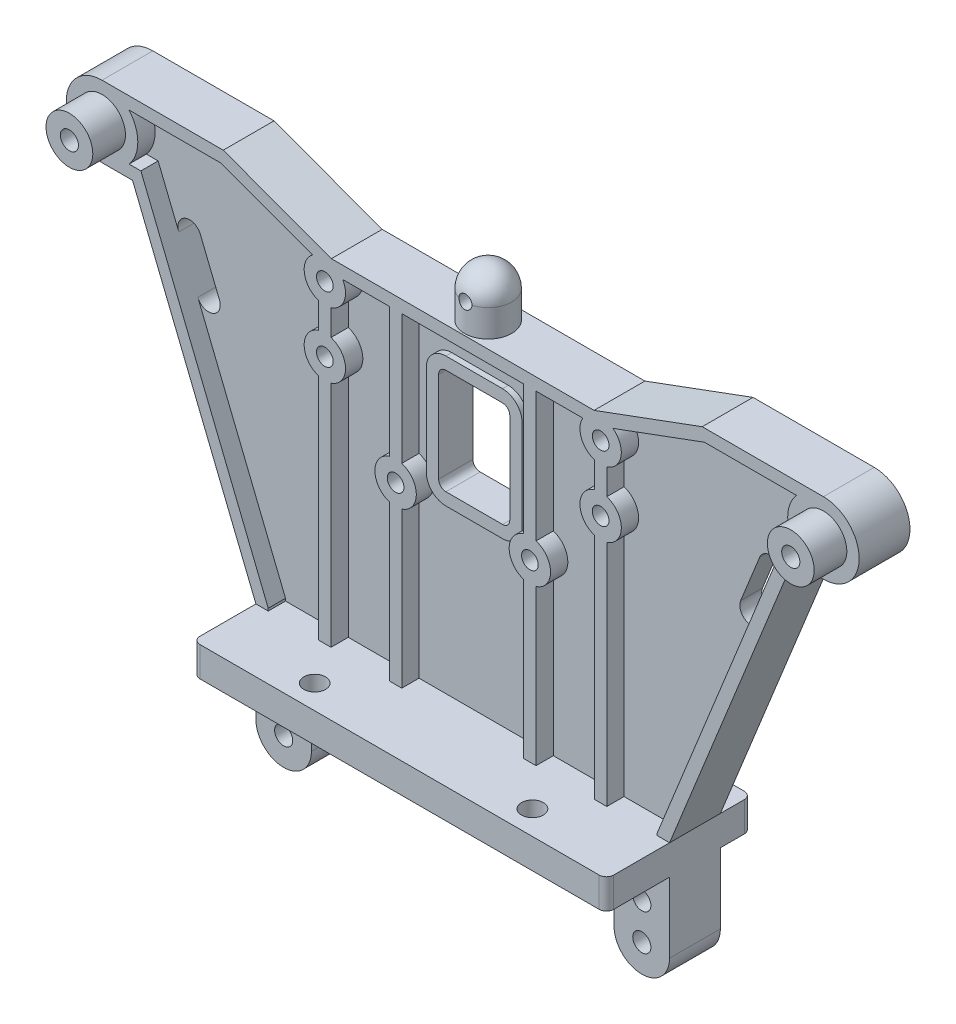
from build123d import *
from build123d.topology import SkipClean

# Parameters (mm, degrees)
BOSS_EXTRUDE1_DEPTH     = 3.5
CUT_EXTRUDE1_DEPTH      = 2.38
RIB3_START              = -2.38
RIB3_OUTLINE_R          = 1.15
RIB3_DEPTH              = 2.38
CUT_EXTRUDE2_DEPTH      = 85.268825938
CUT_EXTRUDE2_DEPTH_BACK = 85.268825938
SKETCH5_R               = 1.15
SKETCH5_R_2             = 1.25
CUT_EXTRUDE3_DEPTH      = 1.6
RIB6_START              = -1.6
RIB6_OUTLINE_R          = 1.15
RIB6_DEPTH              = 1.6
BOSS_EXTRUDE2_START     = 6.88
SKETCH8_R               = 3.225
SKETCH8_R_2             = 1.25
BOSS_EXTRUDE2_DEPTH     = 6.88
SKETCH9_R               = 1.5
BOSS_EXTRUDE3_DEPTH     = 4.1
SKETCH10_R              = 1.5
CUT_EXTRUDE4_DEPTH      = 11.5
EXTRUDE_THIN1_START     = 0.9
EXTRUDE_THIN1_DEPTH     = 0.9
EXTRUDE_THIN2_DEPTH     = 0.8
CUT_EXTRUDE5_DEPTH      = 86.021942021
CUT_EXTRUDE5_DEPTH_BACK = 86.021942021
SKETCH14_R              = 0.9


# Read off the part's stored shape, not the designer's step: Rib3, Rib6
with BuildPart() as part:
    # Sketch1 → Boss-Extrude1 (new, symmetric)
    with BuildSketch(Plane.XY):
        with BuildLine():
            Line((-49.7, 5.5), (-33, 5.5))
            Line((-33, 5.5), (-18.1, 0))
            Line((-18.1, 0), (0, 0))
            Line((0, 0), (0, -50.5))
            Line((0, -50.5), (-20.85, -50.5))
            Line((-20.85, -50.5), (-20.85, -60.175))
            ThreePointArc((-20.85, -60.175), (-24.675, -64), (-28.5, -60.175))
            Line((-28.5, -60.175), (-28.5, -46.4))
            Line((-28.5, -46.4), (-45.5, -4.35))
            Line((-45.5, -4.35), (-49.7, -4.35))
            ThreePointArc((-49.7, -4.35), (-54.625, 0.575), (-49.7, 5.5))
        make_face()
    extrude(amount=BOSS_EXTRUDE1_DEPTH, both=True)

    # Sketch3 → Cut-Extrude1 (cut)
    with BuildSketch(Plane.XY.offset(3.5)):
        with BuildLine():
            ThreePointArc((-49.7, 3.8), (-52.925, 0.575), (-49.7, -2.65))
            Line((-49.7, -2.65), (-44.35360594, -2.65))
            Line((-44.35360594, -2.65), (-26.8, -46.069360574))
            Line((-26.8, -46.069360574), (-26.8, -46.4))
            Line((-26.8, -46.4), (0, -46.4))
            Line((0, -46.4), (0, -1.7))
            Line((0, -1.7), (-18.403742086, -1.7))
            Line((-18.403742086, -1.7), (-33.303742086, 3.8))
            Line((-33.303742086, 3.8), (-49.7, 3.8))
        make_face()
    extrude(amount=-CUT_EXTRUDE1_DEPTH, mode=Mode.SUBTRACT)

    # Rib3 outline → Rib3 (add)
    # profile 1 of 3: a face of its own
    with BuildSketch(Plane.XY.offset(3.5).offset(RIB3_START)):
        with BuildLine():
            ThreePointArc((-10.1, -19.579705898), (-12.1, -22.3), (-10.1, -25.020294102))
            Line((-10.1, -25.020294102), (-10.1, -46.4))
            Line((-10.1, -46.4), (-8.4, -46.4))
            Line((-8.4, -46.4), (-8.4, -25.020294102))
            ThreePointArc((-8.4, -25.020294102), (-6.4, -22.3), (-8.4, -19.579705898))
            Line((-8.4, -19.579705898), (-8.4, -1.7))
            Line((-8.4, -1.7), (-10.1, -1.7))
            Line((-10.1, -1.7), (-10.1, -19.579705898))
        make_face()
        with Locations((-9.25, -22.3)):
            Circle(RIB3_OUTLINE_R, mode=Mode.SUBTRACT)
    # profile 2 of 3: a face of its own
    with BuildSketch(Plane.XY.offset(3.5).offset(RIB3_START)):
        with BuildLine():
            ThreePointArc((-45.977769486, -2.65), (-44.775, 0.575), (-45.977769486, 3.8))
            Line((-45.977769486, 3.8), (-49.7, 3.8))
            ThreePointArc((-49.7, 3.8), (-46.475, 0.575), (-49.7, -2.65))
            Line((-49.7, -2.65), (-45.977769486, -2.65))
        make_face()
    # profile 3 of 3: a face of its own
    with BuildSketch(Plane.XY.offset(3.5).offset(RIB3_START)):
        with BuildLine():
            Line((-19.85, -46.4), (-18.15, -46.4))
            Line((-18.15, -46.4), (-18.15, -14.870294102))
            ThreePointArc((-18.15, -14.870294102), (-16.15, -12.15), (-18.15, -9.429705898))
            Line((-18.15, -9.429705898), (-18.15, -5.870294102))
            ThreePointArc((-18.15, -5.870294102), (-16.339881586, -4.172873415), (-16.546431171, -1.7))
            Line((-16.546431171, -1.7), (-18.403742086, -1.7))
            Line((-18.403742086, -1.7), (-20.690852857, -0.855764481))
            ThreePointArc((-20.690852857, -0.855764481), (-21.81075793, -3.621317155), (-19.85, -5.870294102))
            Line((-19.85, -5.870294102), (-19.85, -9.429705898))
            ThreePointArc((-19.85, -9.429705898), (-21.85, -12.15), (-19.85, -14.870294102))
            Line((-19.85, -14.870294102), (-19.85, -46.4))
        make_face()
        with Locations((-19, -12.15)):
            Circle(RIB3_OUTLINE_R, mode=Mode.SUBTRACT)
        with Locations((-19, -3.15)):
            Circle(RIB3_OUTLINE_R, mode=Mode.SUBTRACT)
    extrude(amount=RIB3_DEPTH)

    # Sketch5 → Cut-Extrude2 (cut, two sides: drawn at the far end of the back side and taken through both)
    with BuildSketch(Plane.XY.offset(1.12).offset(-CUT_EXTRUDE2_DEPTH_BACK)):
        with Locations(Location((-19, -3.15, 0), (0, 0, 180))):
            Circle(SKETCH5_R)
        with Locations(Location((-19, -12.15, 0), (0, 0, 180))):
            Circle(SKETCH5_R)
        with Locations(Location((-9.25, -22.3, 0), (0, 0, 180))):
            Circle(SKETCH5_R)
        with Locations((-24.675, -60.175)):
            Circle(SKETCH5_R_2)
        with Locations((-24.675, -55.175)):
            Circle(SKETCH5_R_2)
        with Locations((-49.7, 0.575)):
            Circle(SKETCH5_R_2)
        with BuildLine():
            Line((0, -7), (-3.9, -7))
            ThreePointArc((-3.9, -7), (-4.607106781, -7.292893219), (-4.9, -8))
            Line((-4.9, -8), (-4.9, -20.5))
            ThreePointArc((-4.9, -20.5), (-4.607106781, -21.207106781), (-3.9, -21.5))
            Line((-3.9, -21.5), (0, -21.5))
            Line((0, -21.5), (0, -7))
        make_face()
        with BuildLine():
            Line((-38.536824782, -8.500305063), (-35.913159432, -14.990018472))
            ThreePointArc((-35.913159432, -14.990018472), (-36.79682756, -17.073076474), (-38.879885562, -16.189408346))
            Line((-38.879885562, -16.189408346), (-41.503550912, -9.699694937))
            ThreePointArc((-41.503550912, -9.699694937), (-40.619882784, -7.616636935), (-38.536824782, -8.500305063))
        make_face()
    extrude(amount=CUT_EXTRUDE2_DEPTH + CUT_EXTRUDE2_DEPTH_BACK, mode=Mode.SUBTRACT)

    # Sketch6 → Cut-Extrude3 (cut)
    with SkipClean():  # the faces are left unmerged after this step: merging them gives an invalid solid
        with BuildSketch(Plane(origin=(0, 0, -3.5), x_dir=(-1, 0, 0), z_dir=(0, 0, -1))):
            with BuildLine():
                Line((18.403742086, -1.7), (0, -1.7))
                Line((0, -1.7), (0, -46.4))
                Line((0, -46.4), (26.8, -46.4))
                Line((26.8, -46.4), (26.8, -46.069360574))
                Line((26.8, -46.069360574), (44.35360594, -2.65))
                Line((44.35360594, -2.65), (45.977769486, -2.65))
                ThreePointArc((45.977769486, -2.65), (44.775, 0.575), (45.977769486, 3.8))
                Line((45.977769486, 3.8), (33.303742086, 3.8))
                Line((33.303742086, 3.8), (18.403742086, -1.7))
            make_face()
        extrude(amount=-CUT_EXTRUDE3_DEPTH, mode=Mode.SUBTRACT)

    # Rib6 outline → Rib6 (add)
    # profile 1 of 2: a face of its own
    with SkipClean():  # the faces are left unmerged after this step: merging them gives an invalid solid
        with BuildSketch(Plane(origin=(0, 0, -3.5), x_dir=(-1, 0, 0), z_dir=(0, 0, -1)).offset(RIB6_START)):
            with BuildLine():
                ThreePointArc((21.823652487, -11.76336499), (21.176102442, -10.30959837), (19.85, -9.429705898))
                Line((19.85, -9.429705898), (19.85, -5.870294102))
                ThreePointArc((19.85, -5.870294102), (21.81075793, -3.621317155), (20.690852857, -0.855764481))
                Line((20.690852857, -0.855764481), (18.403742086, -1.7))
                Line((18.403742086, -1.7), (16.546431171, -1.7))
                ThreePointArc((16.546431171, -1.7), (16.339881586, -4.172873415), (18.15, -5.870294102))
                Line((18.15, -5.870294102), (18.15, -9.429705898))
                ThreePointArc((18.15, -9.429705898), (16.15, -12.15), (18.15, -14.870294102))
                Line((18.15, -14.870294102), (18.15, -46.4))
                Line((18.15, -46.4), (19.85, -46.4))
                Line((19.85, -46.4), (19.85, -14.870294102))
                ThreePointArc((19.85, -14.870294102), (20.423464199, -14.619058459), (20.928233998, -14.248669495))
                Line((20.928233998, -14.248669495), (44.863841489, -0.356233513))
                ThreePointArc((44.863841489, -0.356233513), (44.775362506, 0.634754132), (44.887860617, 1.623303179))
                Line((44.887860617, 1.623303179), (21.823652487, -11.76336499))
            make_face()
            with Locations((19, -12.15)):
                Circle(RIB6_OUTLINE_R, mode=Mode.SUBTRACT)
            with Locations((19, -3.15)):
                Circle(RIB6_OUTLINE_R, mode=Mode.SUBTRACT)
        # profile 2 of 2: a face of its own
        with BuildSketch(Plane(origin=(0, 0, -3.5), x_dir=(-1, 0, 0), z_dir=(0, 0, -1)).offset(RIB6_START)):
            with BuildLine():
                ThreePointArc((8.4, -25.020294102), (12.1, -22.3), (8.4, -19.579705898))
                ThreePointArc((8.4, -19.579705898), (6.4, -22.3), (8.4, -25.020294102))
            make_face()
            with Locations((9.25, -22.3)):
                Circle(RIB6_OUTLINE_R, mode=Mode.SUBTRACT)
        extrude(amount=RIB6_DEPTH)

    # Sketch8 → Boss-Extrude2 (add)
    with SkipClean():  # the faces are left unmerged after this step: merging them gives an invalid solid
        with BuildSketch(Plane.XY.offset(1.12).offset(BOSS_EXTRUDE2_START)):
            with Locations((-49.7, 0.575)):
                Circle(SKETCH8_R)
            with Locations((-49.7, 0.575)):
                Circle(SKETCH8_R_2, mode=Mode.SUBTRACT)
        extrude(amount=-BOSS_EXTRUDE2_DEPTH)

    # Sketch9 → Boss-Extrude3 (add)
    with SkipClean():  # the faces are left unmerged after this step: merging them gives an invalid solid
        with BuildSketch(Plane.XZ.offset(50.5)):
            with BuildLine():
                Line((0, -7.8), (-27.5, -7.8))
                ThreePointArc((-27.5, -7.8), (-28.207106781, -7.507106781), (-28.5, -6.8))
                Line((-28.5, -6.8), (-28.5, 11.2))
                ThreePointArc((-28.5, 11.2), (-28.207106781, 11.907106781), (-27.5, 12.2))
                Line((-27.5, 12.2), (0, 12.2))
                Line((0, 12.2), (0, -7.8))
            make_face()
            with Locations(Location((-15, 8.9, 0), (0, 0, 270))):
                Circle(SKETCH9_R, mode=Mode.SUBTRACT)
            with Locations((-13.85, -4.5)):
                Circle(SKETCH9_R, mode=Mode.SUBTRACT)
        extrude(amount=-BOSS_EXTRUDE3_DEPTH)

    # Sketch10 → Cut-Extrude4 (cut)
    with SkipClean():  # the faces are left unmerged after this step: merging them gives an invalid solid
        with BuildSketch(Plane.XZ.offset(50.5)):
            with Locations(Location((-13.85, -4.5, 0), (0, 0, 270))):
                Circle(SKETCH10_R)
        extrude(amount=-CUT_EXTRUDE4_DEPTH, mode=Mode.SUBTRACT)

    # Mirror1: part across plane


with BuildPart() as part_1:
    with SkipClean():  # the faces are left unmerged after this step: merging them gives an invalid solid
        add(part.part)
        add(part.part.mirror(Plane(origin=(0, -50.5, 3.5), x_dir=(0, 0, 1), z_dir=(-1, 0, 0))))

    # Sketch11 → Extrude-Thin1 (add)
    with SkipClean():  # the faces are left unmerged after this step: merging them gives an invalid solid
        with BuildSketch(Plane(origin=(0, 0, -1.9), x_dir=(-1, 0, 0), z_dir=(0, 0, -1)).offset(EXTRUDE_THIN1_START)):
            with BuildLine():
                Line((6.6, -8), (6.6, -20.5))
                ThreePointArc((6.6, -20.5), (5.809188309, -22.409188309), (3.9, -23.2))
                Line((3.9, -23.2), (-3.9, -23.2))
                ThreePointArc((-3.9, -23.2), (-5.809188309, -22.409188309), (-6.6, -20.5))
                Line((-6.6, -20.5), (-6.6, -8))
                ThreePointArc((-6.6, -8), (-5.809188309, -6.090811691), (-3.9, -5.3))
                Line((-3.9, -5.3), (3.9, -5.3))
                ThreePointArc((3.9, -5.3), (5.809188309, -6.090811691), (6.6, -8))
            make_face()
            with BuildLine():
                Line((4.9, -8), (4.9, -20.5))
                ThreePointArc((4.9, -20.5), (4.607106781, -21.207106781), (3.9, -21.5))
                Line((3.9, -21.5), (-3.9, -21.5))
                ThreePointArc((-3.9, -21.5), (-4.607106781, -21.207106781), (-4.9, -20.5))
                Line((-4.9, -20.5), (-4.9, -8))
                ThreePointArc((-4.9, -8), (-4.607106781, -7.292893219), (-3.9, -7))
                Line((-3.9, -7), (3.9, -7))
                ThreePointArc((3.9, -7), (4.607106781, -7.292893219), (4.9, -8))
            make_face(mode=Mode.SUBTRACT)
        extrude(amount=-EXTRUDE_THIN1_DEPTH)

    # Sketch12 → Extrude-Thin2 (add)
    with SkipClean():  # the faces are left unmerged after this step: merging them gives an invalid solid
        with BuildSketch(Plane.XY.offset(1.12)):
            with BuildLine():
                Line((-3.9, -23.2), (3.9, -23.2))
                ThreePointArc((3.9, -23.2), (5.809188309, -22.409188309), (6.6, -20.5))
                Line((6.6, -20.5), (6.6, -8))
                ThreePointArc((6.6, -8), (5.809188309, -6.090811691), (3.9, -5.3))
                Line((3.9, -5.3), (-3.9, -5.3))
                ThreePointArc((-3.9, -5.3), (-5.809188309, -6.090811691), (-6.6, -8))
                Line((-6.6, -8), (-6.6, -20.5))
                ThreePointArc((-6.6, -20.5), (-5.809188309, -22.409188309), (-3.9, -23.2))
            make_face()
            with BuildLine():
                Line((-3.9, -21.5), (3.9, -21.5))
                ThreePointArc((3.9, -21.5), (4.607106781, -21.207106781), (4.9, -20.5))
                Line((4.9, -20.5), (4.9, -8))
                ThreePointArc((4.9, -8), (4.607106781, -7.292893219), (3.9, -7))
                Line((3.9, -7), (-3.9, -7))
                ThreePointArc((-3.9, -7), (-4.607106781, -7.292893219), (-4.9, -8))
                Line((-4.9, -8), (-4.9, -20.5))
                ThreePointArc((-4.9, -20.5), (-4.607106781, -21.207106781), (-3.9, -21.5))
            make_face(mode=Mode.SUBTRACT)
        extrude(amount=EXTRUDE_THIN2_DEPTH)

    # Sketch13 → Revolve2 (revolve)
    with SkipClean():  # the faces are left unmerged after this step: merging them gives an invalid solid
        with BuildSketch(Plane(origin=(0, 0, 0), x_dir=(0, 0, -1), z_dir=(1, 0, 0)), mode=Mode.PRIVATE) as revolve2_sk:
            with BuildLine():
                Line((-3.25, 3.75), (-3.25, 0))
                Line((-3.25, 0), (0, 0))
                Line((0, 0), (0, 7))
                ThreePointArc((0, 7), (-2.298097039, 6.048097039), (-3.25, 3.75))
            make_face()
            with BuildLine():
                Line((0, 7), (0, 0))
                Line((0, 0), (3.25, 0))
                Line((3.25, 0), (3.25, 3.75))
                ThreePointArc((3.25, 3.75), (2.298097039, 6.048097039), (0, 7))
            make_face()
        revolve(revolve2_sk.sketch.rotate(Axis((0, 7, 0), (0, -1, 0)), 180), axis=Axis((0, 7, 0), (0, -1, 0)))

    # Sketch14 → Cut-Extrude5 (cut, two sides: drawn at the far end of the back side and taken through both)
    with SkipClean():  # the faces are left unmerged after this step: merging them gives an invalid solid
        with BuildSketch(Plane.XY.offset(-CUT_EXTRUDE5_DEPTH_BACK)):
            with Locations((0, 3.75)):
                Circle(SKETCH14_R)
        extrude(amount=CUT_EXTRUDE5_DEPTH + CUT_EXTRUDE5_DEPTH_BACK, mode=Mode.SUBTRACT)


solid = part_1.part
